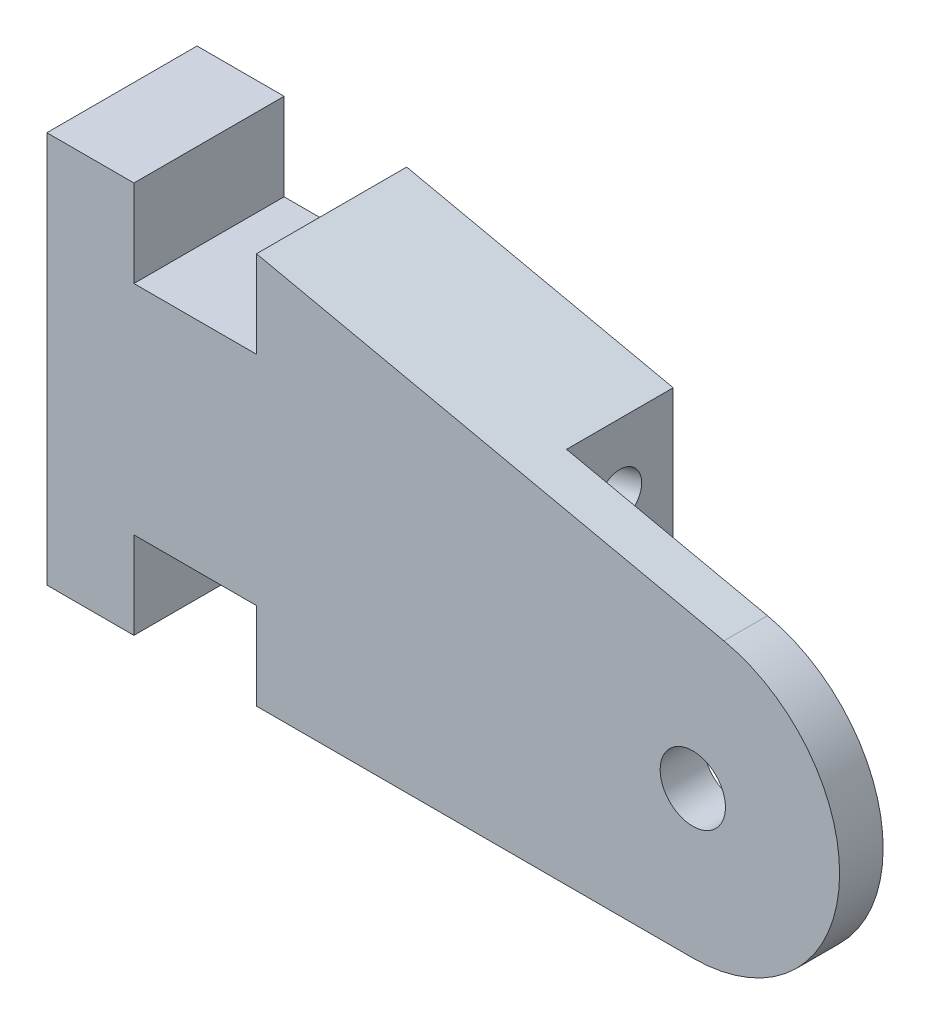
from build123d import *

# Parameters (mm, degrees)
SKETCH1_R           = 1.5
BOSS_EXTRUDE1_DEPTH = 6.9
CUT_EXTRUDE2_DEPTH  = 4.9
SKETCH5_R           = 1
CUT_EXTRUDE3_DEPTH  = 7
SKETCH8_R           = 1
CUT_EXTRUDE5_DEPTH  = 17


with BuildPart() as part:
    # Sketch1 → Boss-Extrude1 (new body)
    with BuildSketch(Plane.XY):
        with BuildLine():
            Line((0, 0), (0, 18.000341084))
            Line((0, 18.000341084), (4, 18.000341084))
            Line((4, 18.000341084), (4, 14.000341084))
            Line((4, 14.000341084), (9.631516349, 14.000341084))
            Line((9.631516349, 14.000341084), (9.631516349, 18.000341084))
            Line((9.631516349, 18.000341084), (31.10792826, 13.336453737))
            ThreePointArc((31.10792826, 13.336453737), (36.383041872, 6.025227564), (29.676516349, 0))
            Line((29.676516349, 0), (9.631516349, 0))
            Line((9.631516349, 0), (9.631516349, 4))
            Line((9.631516349, 4), (4, 4))
            Line((4, 4), (4, 0))
            Line((4, 0), (0, 0))
        make_face()
        with Locations((29.676516349, 6.745044143)):
            Circle(SKETCH1_R, mode=Mode.SUBTRACT)
    extrude(amount=BOSS_EXTRUDE1_DEPTH)

    # Sketch4 → Cut-Extrude2 (cut)
    with BuildSketch(Plane.XY):
        with BuildLine():
            Line((21.876472206, 0), (21.876472206, 15.341186709))
            Line((21.876472206, 15.341186709), (31.10792826, 13.336453737))
            ThreePointArc((31.10792826, 13.336453737), (36.383041872, 6.025227564), (29.676516349, 0))
            Line((29.676516349, 0), (21.876472206, 0))
        make_face()
    extrude(amount=CUT_EXTRUDE2_DEPTH, mode=Mode.SUBTRACT)

    # Sketch5 → Cut-Extrude3 (cut)
    with BuildSketch(Plane.ZY):
        with Locations((2.45, 8)):
            Circle(SKETCH5_R)
    extrude(amount=-CUT_EXTRUDE3_DEPTH, mode=Mode.SUBTRACT)

    # Sketch8 → Cut-Extrude5 (cut)
    with BuildSketch(Plane(origin=(24.246323118, 6.496782699, 0), x_dir=(0, 0, -1), z_dir=(0.9659258262890718, 0.25881904510250786, 0))):
        with Locations((-2.45, 6.201190468)):
            Circle(SKETCH8_R)
    extrude(amount=-CUT_EXTRUDE5_DEPTH, mode=Mode.SUBTRACT)


solid = part.part
